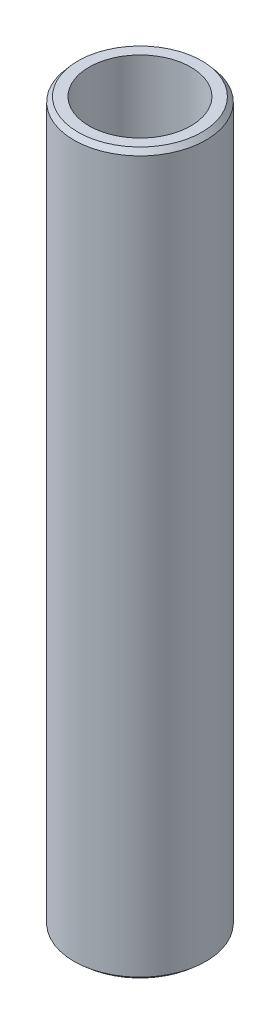
from build123d import *
from OCP.BRepFilletAPI import BRepFilletAPI_MakeChamfer

# Parameters (mm, degrees)
SKETCH1_R           = 55
BOSS_EXTRUDE1_DEPTH = 600
SKETCH2_R           = 42.428929669
CUT_EXTRUDE1_DEPTH  = 606.020660804
CHAMFER1_SIZE       = 3.992115239
CHAMFER1_SIZE2      = 3.452940113


with BuildPart() as part:
    # Sketch1 → Boss-Extrude1 (new body)
    with BuildSketch(Plane(origin=(0, 0, 0), x_dir=(1, 0, 0), z_dir=(0, 1, 0))):
        Circle(SKETCH1_R)
    extrude(amount=BOSS_EXTRUDE1_DEPTH)

    # Sketch2 → Cut-Extrude1 (cut, through all)
    with BuildSketch(Plane(origin=(0, 0, 0), x_dir=(1, 0, 0), z_dir=(0, 1, 0))):
        Circle(SKETCH2_R)
    extrude(amount=CUT_EXTRUDE1_DEPTH, mode=Mode.SUBTRACT)

    # Chamfer1: one chamfer whose edges measure the first distance from different faces: ONE call of the kernel's chamfer builder (chamfer() names one face for all edges)
    chamfer1_edges_1 = [part.edges().sort_by_distance(p)[0] for p in [
        (-55, 600, 0),
    ]]
    chamfer1_side_1 = [part.faces().sort_by_distance(p)[0] for p in [
        (-55, 300, 0),
    ]]
    chamfer1_edges_2 = [part.edges().sort_by_distance(p)[0] for p in [
        (-55, 0, 0),
    ]]
    chamfer1_side_2 = [part.faces().sort_by_distance(p)[0] for p in [
        (-53.444365081, 0, 0),
    ]]
    chamfer1 = BRepFilletAPI_MakeChamfer(part.part.solid().wrapped)
    for e in chamfer1_edges_1:
        chamfer1.Add(CHAMFER1_SIZE, CHAMFER1_SIZE2, e.wrapped, chamfer1_side_1[0].wrapped)  # the first distance lies on this face
    for e in chamfer1_edges_2:
        chamfer1.Add(CHAMFER1_SIZE, CHAMFER1_SIZE2, e.wrapped, chamfer1_side_2[0].wrapped)  # the first distance lies on this face
    add(Compound.cast(chamfer1.Shape()), mode=Mode.REPLACE)


solid = part.part
